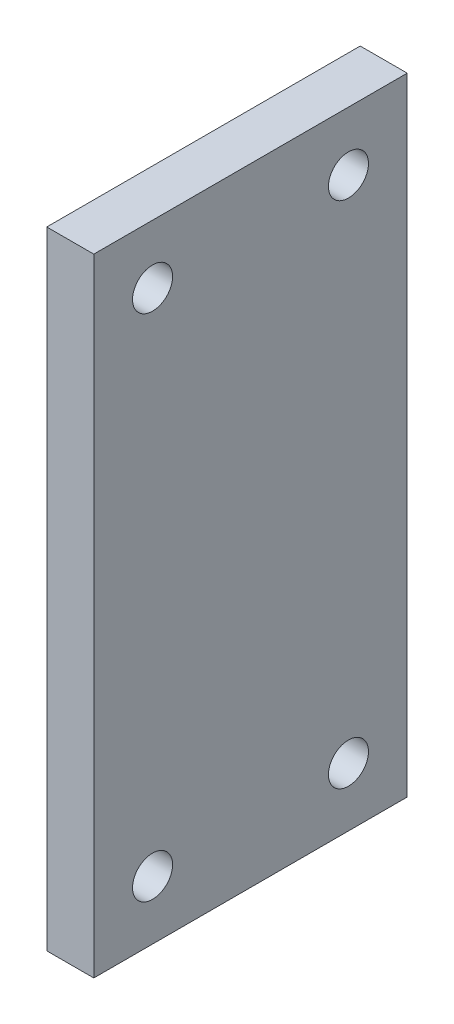
from build123d import *

# Parameters (mm, degrees)
SKETCH1_W           = 80
SKETCH1_H           = 40
BOSS_EXTRUDE2_DEPTH = 6
CUT_EXTRUDE3_REACH  = 47.122
SKETCH1_3_R         = 2.555


with BuildPart() as part:
    # Sketch1 → Boss-Extrude2 (new body)
    with BuildSketch(Plane.YZ):
        Rectangle(SKETCH1_W, SKETCH1_H)
    extrude(amount=BOSS_EXTRUDE2_DEPTH)

    # Sketch1<3> → Cut-Extrude3 (cut, up to next)
    with BuildSketch(Plane.YZ, mode=Mode.PRIVATE) as cut_extrude3_sk1:
        with Locations((-32.5, 12.5)):
            Circle(SKETCH1_3_R)
    cut_extrude3_tool1 = extrude(cut_extrude3_sk1.sketch, amount=CUT_EXTRUDE3_REACH, mode=Mode.PRIVATE) & part.part
    # Sketch1<3> → Cut-Extrude3 (cut, up to next)
    with BuildSketch(Plane.YZ, mode=Mode.PRIVATE) as cut_extrude3_sk2:
        with Locations((-32.5, -12.5)):
            Circle(SKETCH1_3_R)
    cut_extrude3_tool2 = extrude(cut_extrude3_sk2.sketch, amount=CUT_EXTRUDE3_REACH, mode=Mode.PRIVATE) & part.part
    # Sketch1<3> → Cut-Extrude3 (cut, up to next)
    with BuildSketch(Plane.YZ, mode=Mode.PRIVATE) as cut_extrude3_sk3:
        with Locations((32.5, -12.5)):
            Circle(SKETCH1_3_R)
    cut_extrude3_tool3 = extrude(cut_extrude3_sk3.sketch, amount=CUT_EXTRUDE3_REACH, mode=Mode.PRIVATE) & part.part
    # Sketch1<3> → Cut-Extrude3 (cut, up to next)
    with BuildSketch(Plane.YZ, mode=Mode.PRIVATE) as cut_extrude3_sk4:
        with Locations((32.5, 12.5)):
            Circle(SKETCH1_3_R)
    cut_extrude3_tool4 = extrude(cut_extrude3_sk4.sketch, amount=CUT_EXTRUDE3_REACH, mode=Mode.PRIVATE) & part.part
    add(cut_extrude3_tool1.solids().sort_by_distance((0, -32.5, 12.5))[0], mode=Mode.SUBTRACT)
    add(cut_extrude3_tool2.solids().sort_by_distance((0, -32.5, -12.5))[0], mode=Mode.SUBTRACT)
    add(cut_extrude3_tool3.solids().sort_by_distance((0, 32.5, -12.5))[0], mode=Mode.SUBTRACT)
    add(cut_extrude3_tool4.solids().sort_by_distance((0, 32.5, 12.5))[0], mode=Mode.SUBTRACT)


solid = part.part
